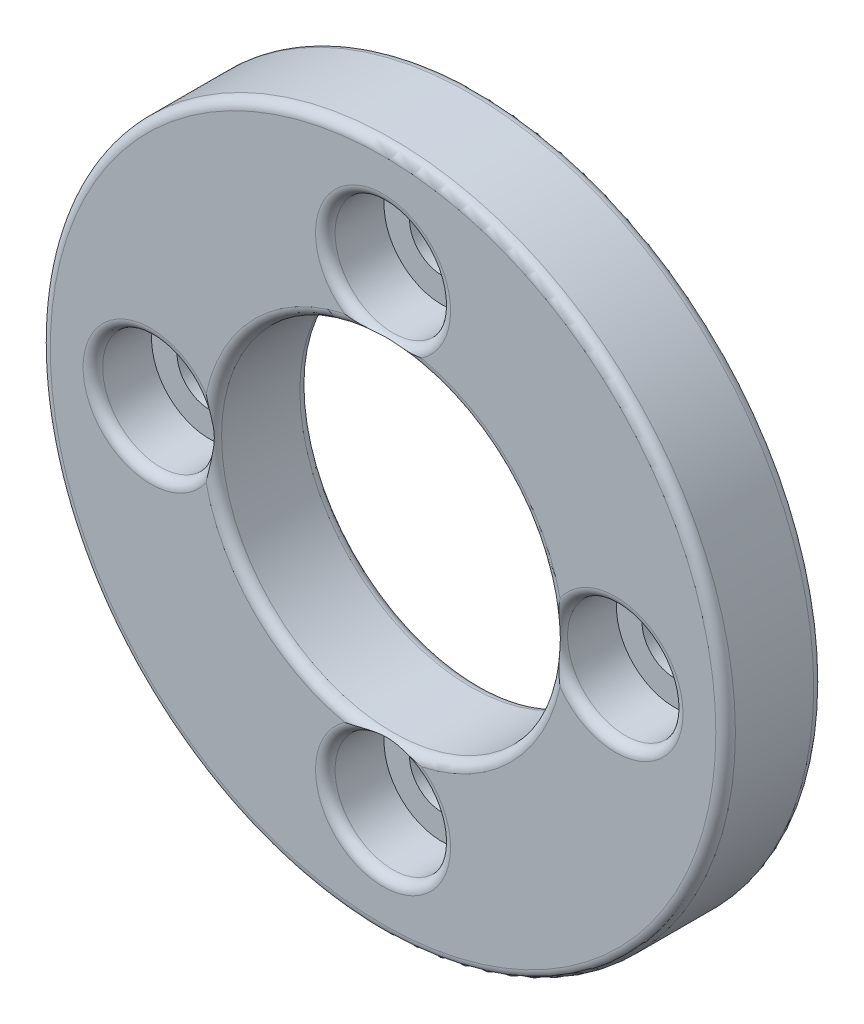
from build123d import *

# Parameters (mm, degrees)
SKIZZE1_R                       = 17.5
SKIZZE1_R_2                     = 15
SKIZZE1_R_3                     = 1.65
SKIZZE1_R_4                     = 8.75
AUFSATZ_LINEAR_AUSTRAGEN1_DEPTH = 5
SKIZZE2_R                       = 2.95
SCHNITT_LINEAR_AUSTRAGEN1_DEPTH = 3
VERRUNDUNG1_R                   = 0.5


with BuildPart() as part:
    # Skizze1 → Aufsatz-Linear austragen1 (new body)
    # profile 1 of 2: a face of its own
    with BuildSketch(Plane.XY):
        Circle(SKIZZE1_R)
        Circle(SKIZZE1_R_2, mode=Mode.SUBTRACT)
    # profile 2 of 2: a face of its own
    with BuildSketch(Plane.XY):
        Circle(SKIZZE1_R_2)
        with Locations((-11.875, 0)):
            Circle(SKIZZE1_R_3, mode=Mode.SUBTRACT)
        with Locations((0, -11.875)):
            Circle(SKIZZE1_R_3, mode=Mode.SUBTRACT)
        with Locations((11.875, 0)):
            Circle(SKIZZE1_R_3, mode=Mode.SUBTRACT)
        with Locations((0, 11.875)):
            Circle(SKIZZE1_R_3, mode=Mode.SUBTRACT)
        Circle(SKIZZE1_R_4, mode=Mode.SUBTRACT)
    extrude(amount=AUFSATZ_LINEAR_AUSTRAGEN1_DEPTH)

    # Skizze2 → Schnitt-Linear austragen1 (cut)
    with BuildSketch(Plane.XY.offset(5)):
        with Locations((0, 11.875)):
            Circle(SKIZZE2_R)
        with Locations((11.875, 0)):
            Circle(SKIZZE2_R)
        with Locations((0, -11.875)):
            Circle(SKIZZE2_R)
        with Locations((-11.875, 0)):
            Circle(SKIZZE2_R)
    extrude(amount=-SCHNITT_LINEAR_AUSTRAGEN1_DEPTH, mode=Mode.SUBTRACT)

    # Verrundung1
    # the kernel refuses this fillet: 0.5 mm, written as the material it takes off along each edge
    with BuildSketch(Plane(origin=(0, -11.875, 0), x_dir=(1, 0, 0), z_dir=(0, -1, 0))) as verrundung1_piece_1:
        with BuildLine():
            CenterArc((1.65 + VERRUNDUNG1_R, VERRUNDUNG1_R), VERRUNDUNG1_R, 180, 90)
            Line((1.65, VERRUNDUNG1_R), (1.65, 0))
            Line((1.65, 0), (1.65 + VERRUNDUNG1_R, 0))
        make_face()
    revolve(axis=Axis((0, -11.875, 0), (0, 0, 1)), mode=Mode.SUBTRACT)
    with BuildSketch(Plane(origin=(-11.875, 0, 0), x_dir=(1, 0, 0), z_dir=(0, -1, 0))) as verrundung1_piece_2:
        with BuildLine():
            CenterArc((1.65 + VERRUNDUNG1_R, VERRUNDUNG1_R), VERRUNDUNG1_R, 180, 90)
            Line((1.65, VERRUNDUNG1_R), (1.65, 0))
            Line((1.65, 0), (1.65 + VERRUNDUNG1_R, 0))
        make_face()
    revolve(axis=Axis((-11.875, 0, 0), (0, 0, 1)), mode=Mode.SUBTRACT)
    with BuildSketch(Plane(origin=(0, 11.875, 5), x_dir=(1, 0, 0), z_dir=(0, -1, 0))) as verrundung1_piece_3:
        with BuildLine():
            CenterArc((2.95 + VERRUNDUNG1_R, -VERRUNDUNG1_R), VERRUNDUNG1_R, 90, 90)
            Line((2.95, -VERRUNDUNG1_R), (2.95, 0))
            Line((2.95, 0), (2.95 + VERRUNDUNG1_R, 0))
        make_face()
    revolve(axis=Axis((0, 11.875, 5), (0, 0, 1)), mode=Mode.SUBTRACT)
    with BuildSketch(Plane(origin=(0, 0, 5), x_dir=(1, 0, 0), z_dir=(0, -1, 0))) as verrundung1_piece_4:
        with BuildLine():
            CenterArc((8.75 + VERRUNDUNG1_R, -VERRUNDUNG1_R), VERRUNDUNG1_R, 90, 90)
            Line((8.75, -VERRUNDUNG1_R), (8.75, 0))
            Line((8.75, 0), (8.75 + VERRUNDUNG1_R, 0))
        make_face()
    revolve(axis=Axis((0, 0, 5), (0, 0, 1)), mode=Mode.SUBTRACT)
    with BuildSketch(Plane(origin=(11.875, 0, 5), x_dir=(1, 0, 0), z_dir=(0, -1, 0))) as verrundung1_piece_5:
        with BuildLine():
            CenterArc((2.95 + VERRUNDUNG1_R, -VERRUNDUNG1_R), VERRUNDUNG1_R, 90, 90)
            Line((2.95, -VERRUNDUNG1_R), (2.95, 0))
            Line((2.95, 0), (2.95 + VERRUNDUNG1_R, 0))
        make_face()
    revolve(axis=Axis((11.875, 0, 5), (0, 0, 1)), mode=Mode.SUBTRACT)
    with BuildSketch(Plane(origin=(0, -11.875, 5), x_dir=(1, 0, 0), z_dir=(0, -1, 0))) as verrundung1_piece_6:
        with BuildLine():
            CenterArc((2.95 + VERRUNDUNG1_R, -VERRUNDUNG1_R), VERRUNDUNG1_R, 90, 90)
            Line((2.95, -VERRUNDUNG1_R), (2.95, 0))
            Line((2.95, 0), (2.95 + VERRUNDUNG1_R, 0))
        make_face()
    revolve(axis=Axis((0, -11.875, 5), (0, 0, 1)), mode=Mode.SUBTRACT)
    with BuildSketch(Plane(origin=(0, 0, 5), x_dir=(1, 0, 0), z_dir=(0, -1, 0))) as verrundung1_piece_7:
        with BuildLine():
            CenterArc((17.5 - VERRUNDUNG1_R, -VERRUNDUNG1_R), VERRUNDUNG1_R, 0, 90)
            Line((17.5 - VERRUNDUNG1_R, 0), (17.5, 0))
            Line((17.5, 0), (17.5, -VERRUNDUNG1_R))
        make_face()
    revolve(axis=Axis((0, 0, 5), (0, 0, 1)), mode=Mode.SUBTRACT)
    with BuildSketch(Plane(origin=(-11.875, 0, 5), x_dir=(1, 0, 0), z_dir=(0, -1, 0))) as verrundung1_piece_8:
        with BuildLine():
            CenterArc((2.95 + VERRUNDUNG1_R, -VERRUNDUNG1_R), VERRUNDUNG1_R, 90, 90)
            Line((2.95, -VERRUNDUNG1_R), (2.95, 0))
            Line((2.95, 0), (2.95 + VERRUNDUNG1_R, 0))
        make_face()
    revolve(axis=Axis((-11.875, 0, 5), (0, 0, 1)), mode=Mode.SUBTRACT)
    with BuildSketch(Plane(origin=(0, 0, 0), x_dir=(1, 0, 0), z_dir=(0, -1, 0))) as verrundung1_piece_9:
        with BuildLine():
            CenterArc((17.5 - VERRUNDUNG1_R, VERRUNDUNG1_R), VERRUNDUNG1_R, 270, 90)
            Line((17.5 - VERRUNDUNG1_R, 0), (17.5, 0))
            Line((17.5, 0), (17.5, VERRUNDUNG1_R))
        make_face()
    revolve(axis=Axis((0, 0, 0), (0, 0, 1)), mode=Mode.SUBTRACT)
    with BuildSketch(Plane(origin=(0, 0, 0), x_dir=(1, 0, 0), z_dir=(0, -1, 0))) as verrundung1_piece_10:
        with BuildLine():
            CenterArc((8.75 + VERRUNDUNG1_R, VERRUNDUNG1_R), VERRUNDUNG1_R, 180, 90)
            Line((8.75, VERRUNDUNG1_R), (8.75, 0))
            Line((8.75, 0), (8.75 + VERRUNDUNG1_R, 0))
        make_face()
    revolve(axis=Axis((0, 0, 0), (0, 0, 1)), mode=Mode.SUBTRACT)
    with BuildSketch(Plane(origin=(0, 11.875, 0), x_dir=(1, 0, 0), z_dir=(0, -1, 0))) as verrundung1_piece_11:
        with BuildLine():
            CenterArc((1.65 + VERRUNDUNG1_R, VERRUNDUNG1_R), VERRUNDUNG1_R, 180, 90)
            Line((1.65, VERRUNDUNG1_R), (1.65, 0))
            Line((1.65, 0), (1.65 + VERRUNDUNG1_R, 0))
        make_face()
    revolve(axis=Axis((0, 11.875, 0), (0, 0, 1)), mode=Mode.SUBTRACT)
    with BuildSketch(Plane(origin=(11.875, 0, 0), x_dir=(1, 0, 0), z_dir=(0, -1, 0))) as verrundung1_piece_12:
        with BuildLine():
            CenterArc((1.65 + VERRUNDUNG1_R, VERRUNDUNG1_R), VERRUNDUNG1_R, 180, 90)
            Line((1.65, VERRUNDUNG1_R), (1.65, 0))
            Line((1.65, 0), (1.65 + VERRUNDUNG1_R, 0))
        make_face()
    revolve(axis=Axis((11.875, 0, 0), (0, 0, 1)), mode=Mode.SUBTRACT)


solid = part.part
